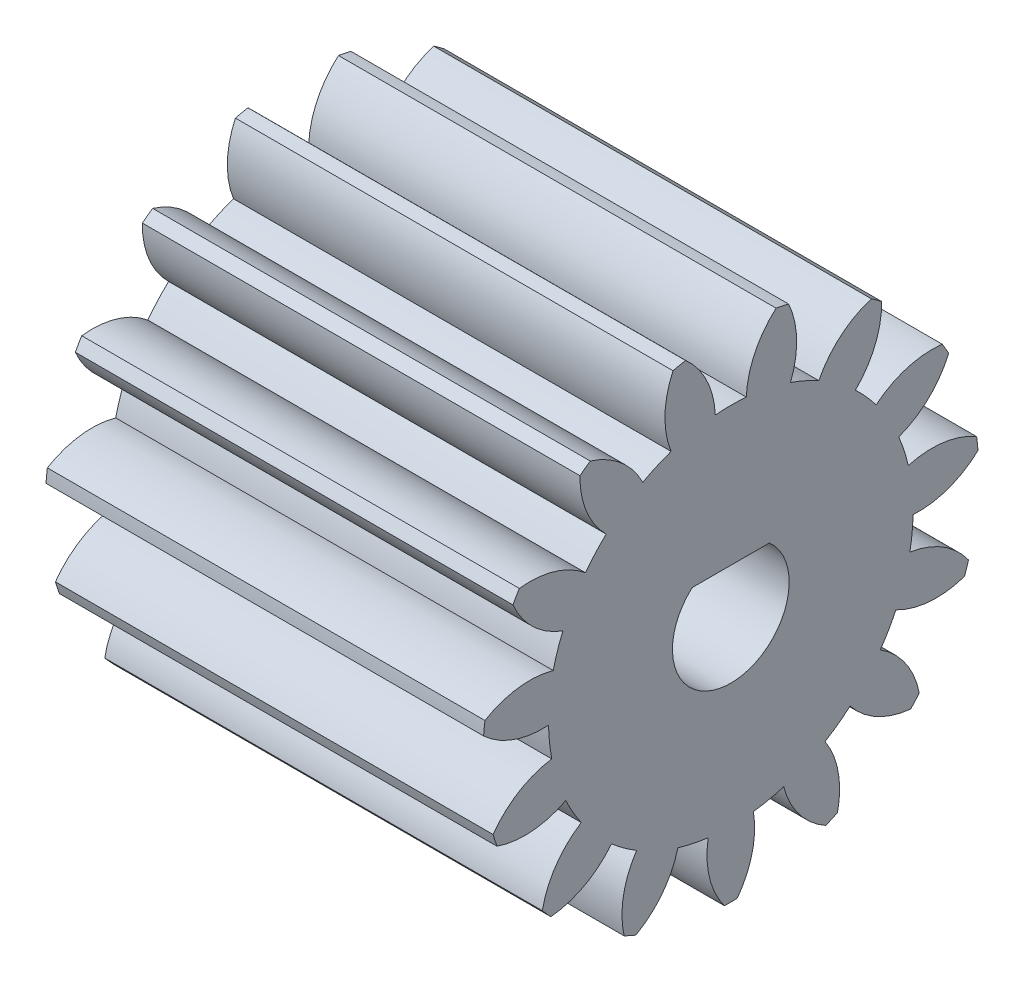
from build123d import *

# Parameters (mm, degrees)
BASPROSKE_W         = 15
BASPROSKE_H         = 8.5
TOOTHCUT_DEPTH      = 20.222382787
TEETHCUTS_COUNT     = 15
TEETHCUTS_ANGLE     = 336
BORSKE_R            = 2
BORE_DEPTH          = 50.0000508
BOSS_EXTRUDE1_DEPTH = 15


with BuildPart() as part:
    # BasProSke → Base-Revolve (revolve)
    with BuildSketch(Plane(origin=(0, 0, 0), x_dir=(1, 0, 0), z_dir=(0, 1, 0))):
        with Locations((7.5, 4.25)):
            Rectangle(BASPROSKE_W, BASPROSKE_H)
    revolve(axis=Axis((-10, 0, 0), (1, 0, 0)))

    # TooCutSke → ToothCut (cut, through all)
    with BuildSketch(Plane(origin=(0, 0, 0), x_dir=(0, 0, -1), z_dir=(1, 0, 0))):
        with BuildLine():
            ThreePointArc((0.531576138, 6.226349477), (0, 6.249), (-0.531576138, 6.226349477))
            ThreePointArc((-0.531576138, 6.226349477), (-0.830301624, 7.411024729), (-1.576608494, 8.378350125))
            ThreePointArc((-1.576608494, 8.378350125), (0, 8.5254), (1.576608494, 8.378350125))
            ThreePointArc((1.576608494, 8.378350125), (0.830301624, 7.411024729), (0.531576138, 6.226349477))
        make_face()
    toothcut = extrude(amount=TOOTHCUT_DEPTH, mode=Mode.SUBTRACT)

    # TeethCuts: ToothCut ×15 about axis
    teethcuts_axis = Axis((-10, 0, 0), (1, 0, 0))
    for i in range(1, TEETHCUTS_COUNT):
        add(toothcut.rotate(teethcuts_axis, i * TEETHCUTS_ANGLE / (TEETHCUTS_COUNT - 1)), mode=Mode.SUBTRACT)

    # BorSke → Bore (cut, symmetric)
    with BuildSketch(Plane(origin=(0, 0, 0), x_dir=(0, 0, -1), z_dir=(1, 0, 0))):
        Circle(BORSKE_R)
    extrude(amount=BORE_DEPTH, both=True, mode=Mode.SUBTRACT)

    # Sketch1 → Boss-Extrude1 (add)
    with BuildSketch(Plane(origin=(15, 0, 0), x_dir=(0, 0, -1), z_dir=(1, 0, 0))):
        with BuildLine():
            ThreePointArc((1.322875656, 1.5), (0, 2), (-1.322875656, 1.5))
            Line((-1.322875656, 1.5), (1.322875656, 1.5))
        make_face()
    extrude(amount=-BOSS_EXTRUDE1_DEPTH)


solid = part.part
